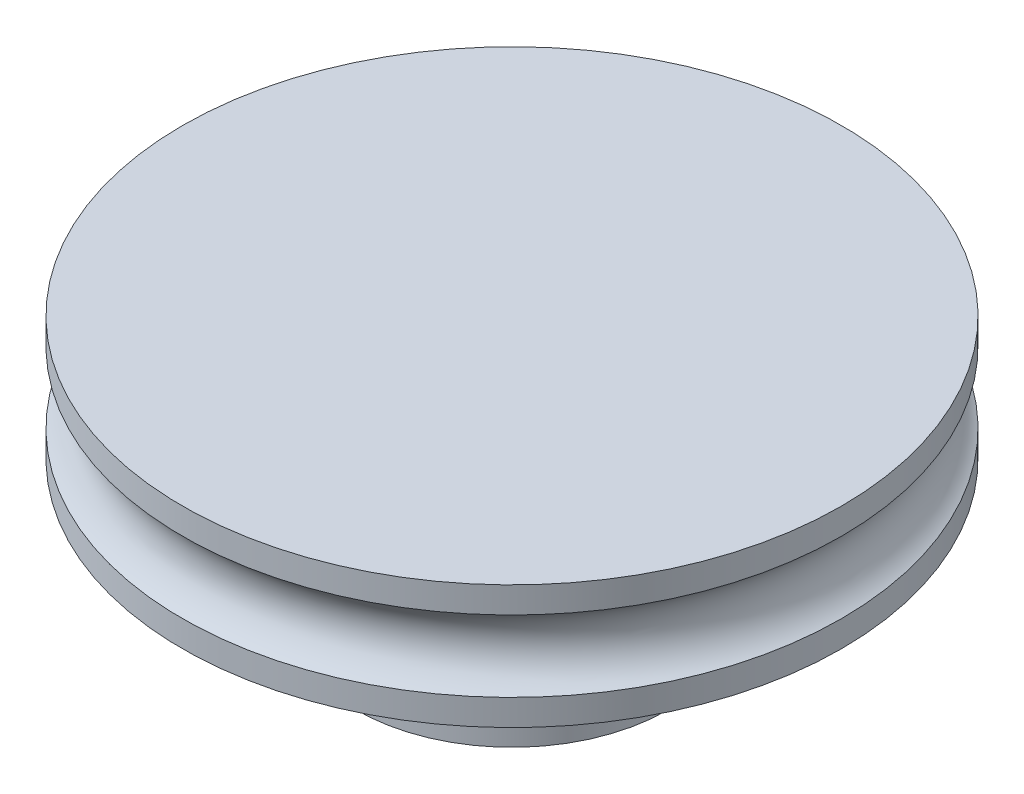
from build123d import *

# Parameters (mm, degrees)
SKETCH7_R           = 6.5
BOSS_EXTRUDE2_DEPTH = 0.396875
FILLET1_R           = 0.79375
SKETCH6_R           = 6
BOSS_EXTRUDE1_DEPTH = 5
SKETCH5_R           = 1.651
CUT_EXTRUDE3_DEPTH  = 8.89


with BuildPart() as part:
    # Sketch2 → Revolve1 (revolve)
    with BuildSketch(Plane.XY):
        with BuildLine():
            Line((0, 0), (0, -2.38125))
            Line((0, -2.38125), (12.7, -2.38125))
            Line((12.7, -2.38125), (12.7, -1.374815329))
            ThreePointArc((12.7, -1.374815329), (11.90625, 0), (12.7, 1.374815329))
            Line((12.7, 1.374815329), (12.7, 2.38125))
            Line((12.7, 2.38125), (0, 2.38125))
            Line((0, 2.38125), (0, 0))
        make_face()
    revolve(axis=Axis((0, 0, 0), (0, 1, 0)))

    # Sketch7 → Boss-Extrude2 (add)
    with BuildSketch(Plane(origin=(0, -2.38125, 0), x_dir=(-1, 0, 0), z_dir=(0, -1, 0))):
        with Locations(Location((0, 0, 0), (0, 0, 180))):
            Circle(SKETCH7_R)
    extrude(amount=BOSS_EXTRUDE2_DEPTH)

    # Fillet1
    # the kernel refuses this fillet: 0.79375 mm, written as the material it adds along each edge
    with BuildSketch(Plane(origin=(0, -2.38125, 0), x_dir=(1, 0, 0), z_dir=(0, 0, -1))) as fillet1_piece_1:
        with BuildLine():
            CenterArc((7.187407664, 0.79375), FILLET1_R, 210, 60)
            Line((6.5, 0.396875), (6.486251847, 0.3889375))
            ThreePointArc((6.486251847, 0.3889375), (6.484125, 0.1984375), (6.484125, 0))
            Line((6.484125, 0), (6.5, -0.015875))
            Line((6.5, -0.015875), (7.187407664, -0.015875))
            Line((7.187407664, -0.015875), (7.187407664, 0))
        make_face()
    revolve(axis=Axis((0, -2.38125, 0), (0, -1, 0)))

    # Sketch6 → Boss-Extrude1 (add)
    with BuildSketch(Plane.XZ.offset(2.778125)):
        Circle(SKETCH6_R)
    extrude(amount=BOSS_EXTRUDE1_DEPTH)

    # Sketch5 → Cut-Extrude3 (cut)
    with BuildSketch(Plane.XZ.offset(7.778125)):
        with Locations((-1.7145, 0)):
            Circle(SKETCH5_R)
        with Locations((1.7145, 0)):
            Circle(SKETCH5_R)
    extrude(amount=-CUT_EXTRUDE3_DEPTH, mode=Mode.SUBTRACT)


solid = part.part
